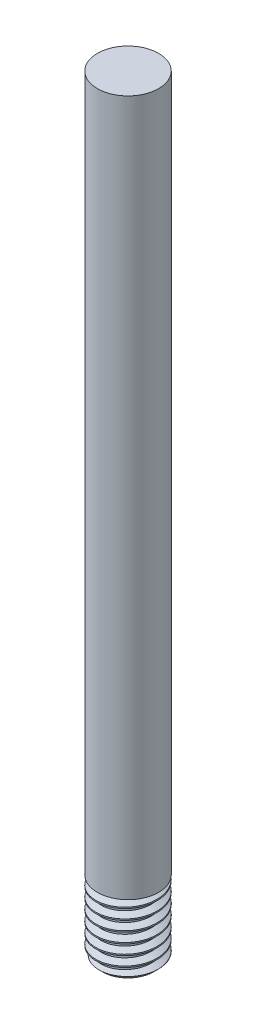
from build123d import *

# Parameters (mm, degrees)
SKETCH1_ONE_SIDE_W = 3
SKETCH1_ONE_SIDE_H = 68.25
SKETCH1_3_W        = 3
SKETCH1_3_H        = 7
CHAMFER1_SIZE      = 0.5
THREAD1_PITCH      = 1


with BuildPart() as part:
    # Sketch1 one side → Revolve1 (revolve)
    with BuildSketch(Plane.XY, mode=Mode.PRIVATE) as revolve1_sk:
        with Locations((1.5, -46.75)):
            Rectangle(SKETCH1_ONE_SIDE_W, SKETCH1_ONE_SIDE_H)
    revolve(revolve1_sk.sketch.rotate(Axis((0, 111.539954176, 0), (0, -1, 0)), 90), axis=Axis((0, 111.539954176, 0), (0, -1, 0)))


with BuildPart() as body_2:
    # Sketch1<3> → Revolve2 (revolve)
    with BuildSketch(Plane.XY, mode=Mode.PRIVATE) as revolve2_sk:
        with Locations((1.5, -84.375)):
            Rectangle(SKETCH1_3_W, SKETCH1_3_H)
    revolve(revolve2_sk.sketch.rotate(Axis((0, 111.539954176, 0), (0, -1, 0)), 90), axis=Axis((0, 111.539954176, 0), (0, -1, 0)))

    # Chamfer1
    chamfer1_edges = [body_2.edges().sort_by_distance(p)[0] for p in [
        (0, -87.875, -3),
    ]]
    chamfer(chamfer1_edges, length=CHAMFER1_SIZE)

    # Thread1: the profile of Thread Profile2 profile screwed along a right-hand helix of 7.5 turns, 8 arcs to a turn; built about Z, then put on its axis
    thread1_z = Axis((0, 0, 0), (0, 0, 1))
    thread1_corners = [(3.0003, 0, -0.000173205), (3.0003, 0, 0.875173202), (2.458734125, 0, 0.562499999), (2.458734125, 0, 0.312499999)]
    with BuildLine(mode=Mode.PRIVATE) as thread1_profile:
        Line(thread1_corners[0], thread1_corners[1])
        Line(thread1_corners[1], thread1_corners[2])
        Line(thread1_corners[2], thread1_corners[3])
        Line(thread1_corners[3], thread1_corners[0])
    thread1_cap = Face(thread1_profile.wire())
    thread1_turn_angles = [0, 22.5, 45, 67.5, 90, 112.5, 135, 157.5, 180, 202.5, 225, 247.5, 270, 292.5, 315, 337.5, 360]
    thread1_turn_weights = [1, 0.9238795325112867, 1, 0.9238795325112867, 1, 0.9238795325112867, 1, 0.9238795325112867, 1, 0.9238795325112867, 1, 0.9238795325112867, 1, 0.9238795325112867, 1, 0.9238795325112867, 1]
    thread1_turn_rails = [Edge.make_bspline([Vector(p[0], p[1], 0).rotate(thread1_z, thread1_turn_angles[k]) / thread1_turn_weights[k] + Vector(0, 0, p[2] + THREAD1_PITCH * thread1_turn_angles[k] / 360) for k in range(17)], [0, 0, 0, 1, 1, 2, 2, 3, 3, 4, 4, 5, 5, 6, 6, 7, 7, 8, 8, 8], 2, thread1_turn_weights) for p in thread1_corners]
    thread1_turn_sides = [Face.make_surface_from_curves(thread1_turn_rails[p[0]], thread1_turn_rails[p[1]]) for p in [(0, 1), (1, 2), (2, 3), (3, 0)]]
    thread1_last_angles = [2520, 2542.5, 2565, 2587.5, 2610, 2632.5, 2655, 2677.5, 2700]
    thread1_last_weights = [1, 0.9238795325112867, 1, 0.9238795325112867, 1, 0.9238795325112867, 1, 0.9238795325113126, 1]
    thread1_last_rails = [Edge.make_bspline([Vector(p[0], p[1], 0).rotate(thread1_z, thread1_last_angles[k]) / thread1_last_weights[k] + Vector(0, 0, p[2] + THREAD1_PITCH * thread1_last_angles[k] / 360) for k in range(9)], [0, 0, 0, 1, 1, 2, 2, 3, 3, 4, 4, 4], 2, thread1_last_weights) for p in thread1_corners]
    thread1_last_sides = [Face.make_surface_from_curves(thread1_last_rails[p[0]], thread1_last_rails[p[1]]) for p in [(0, 1), (1, 2), (2, 3), (3, 0)]]
    thread1 = Plane(origin=(0, -88.375, 0), x_dir=(1, 0, 0), z_dir=(0, 1, 0)) * Solid(Shell([*[p.moved(Location((0, 0, THREAD1_PITCH * i))) for i in range(7) for p in thread1_turn_sides], *thread1_last_sides, thread1_cap, thread1_cap.rotate(thread1_z, 2700).moved(Location((0, 0, THREAD1_PITCH * 2700 / 360)))]))
    add(thread1, mode=Mode.SUBTRACT)


solid = Compound([part.part, body_2.part])
